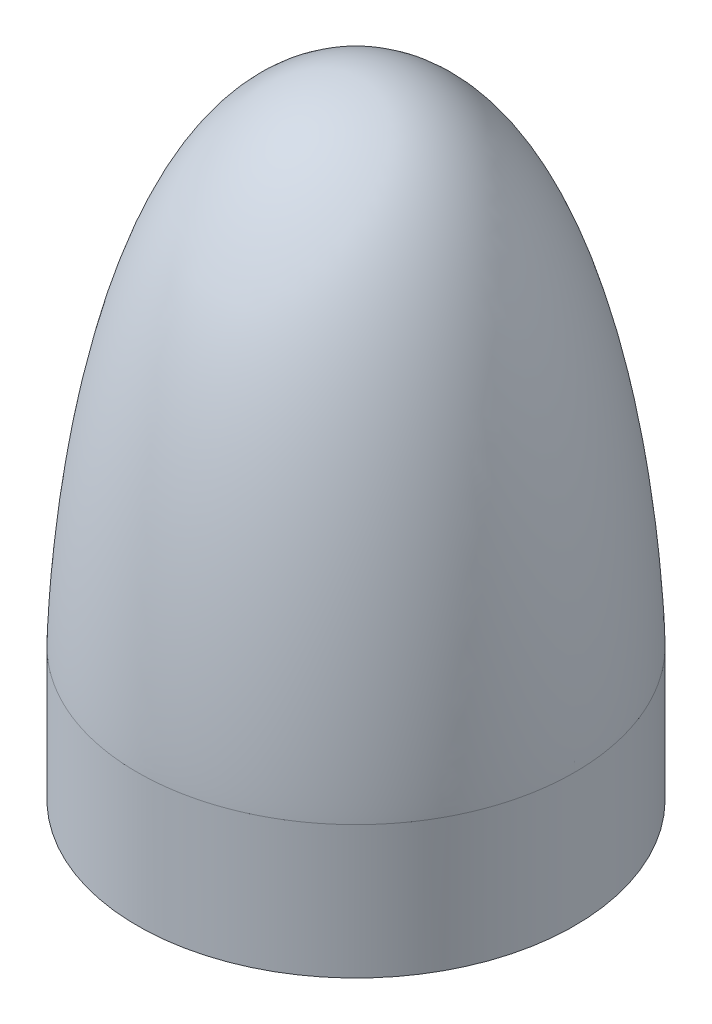
from build123d import *

# Parameters (mm, degrees)
SCALE2_SCALE = 2


with BuildPart() as part:
    # Sketch1 → Revolve1 (revolve)
    with BuildSketch(Plane.XY):
        with BuildLine():
            Line((7, 4.256292026), (7, 0))
            Line((7, 0), (0, 0))
            Line((0, 0), (0, 20))
            add(Edge.make_bspline(
                [(0, 20), (6.748759859, 19.983290112), (7.005059619, 4.256663996), (7, 4.256292026)],
                knots=[0, 0, 0, 0, 0.166417438, 0.166417438, 0.166417438, 0.166417438], degree=3))
        make_face()
    revolve(axis=Axis((0, 0, 0), (0, 1, 0)))


with BuildPart() as part_1:
    # Scale2: scaled about (0, 7.913014441, 0)
    add(part.part.scale(SCALE2_SCALE).moved(Location((0, -7.913014441, 0))))


solid = part_1.part
